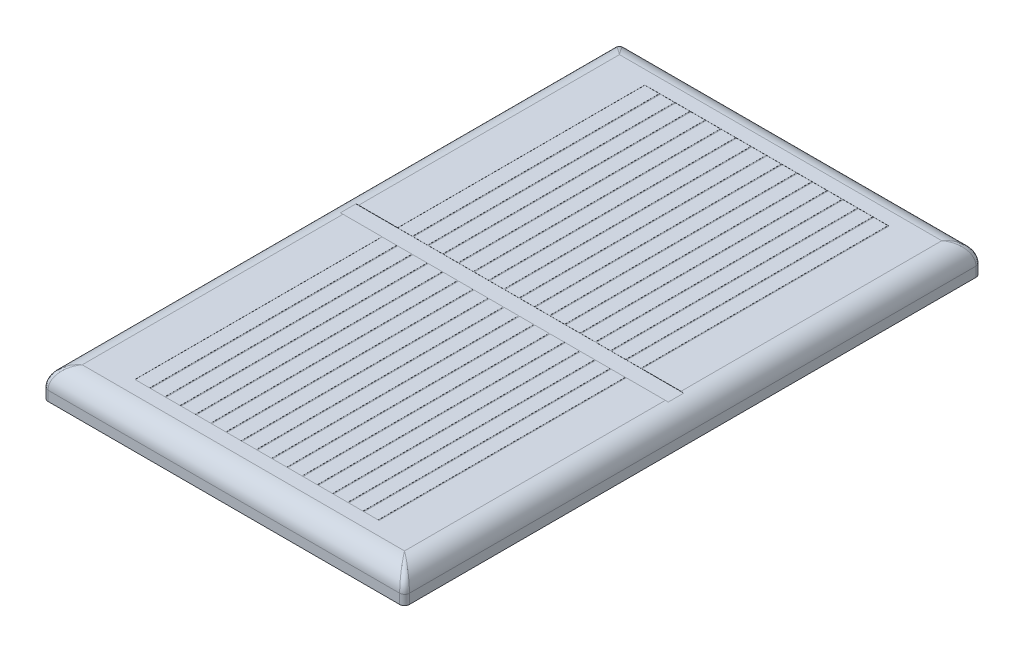
from build123d import *

# Parameters (mm, degrees)
BASES_W                      = 37
BASES_H                      = 59
BASE_DEPTH                   = 1.5
MAINSOLDERPOINTS_R           = 1.5
MAINSOLDERPOINT_DEPTH        = 0.01
SOLDERPOINTS_R               = 1.5
SOLDERPOINT_DEPTH            = 0.01
SOLDERLEG_DEPTH              = 0.005
POLARITYSIGNSS_W             = 4.5
POLARITYSIGNSS_H             = 0.5
POLARITYSIGNS_DEPTH          = 0.005
LIGHTABSORPTIONSECTIONS_W    = 25
LIGHTABSORPTIONSECTIONS_H    = 52.2
LIGHTABSORPTIONSECTION_DEPTH = 0.01
LASSLOTS_W                   = 0.1
LASSLOTS_H                   = 52.2
LASSLOT_DEPTH                = 0.01
LASSLOT_LP_COUNT             = 16
LASSLOT_LP_PITCH             = 1.56
CIRCUITCONNECTION_REACH      = 36.951
CIRCUITCONNECTIONS_W         = 36
CIRCUITCONNECTIONS_H         = 1.6
BASEF_R                      = 2
BASECORNERF_R                = 0.5


with BuildPart() as part:
    # BaseS → Base (new, symmetric)
    with BuildSketch(Plane(origin=(0, 0, 0), x_dir=(1, 0, 0), z_dir=(0, 1, 0))):
        Rectangle(BASES_W, BASES_H)
    extrude(amount=BASE_DEPTH, both=True)

    # MainSolderPointS → MainSolderPoint (add)
    with BuildSketch(Plane(origin=(0, -1.5, 0), x_dir=(-1, 0, 0), z_dir=(0, -1, 0))):
        with Locations(Location((-5, 14.5, 0), (0, 0, 270))):
            Circle(MAINSOLDERPOINTS_R)
    mainsolderpoint = extrude(amount=MAINSOLDERPOINT_DEPTH)

    # SolderPointS → SolderPoint (add)
    with BuildSketch(Plane(origin=(0, -1.5, 0), x_dir=(-1, 0, 0), z_dir=(0, -1, 0))):
        with Locations(Location((-15.5, 0, 0), (0, 0, 270))):
            Circle(SOLDERPOINTS_R)
    solderpoint = extrude(amount=SOLDERPOINT_DEPTH)

    # SolderLegS → SolderLeg (add)
    with BuildSketch(Plane(origin=(0, -1.5, 0), x_dir=(-1, 0, 0), z_dir=(0, -1, 0))):
        with BuildLine():
            Line((-15.5, -1.5), (-5, -1.5))
            ThreePointArc((-5, -1.5), (-3.939339828, -1.060660172), (-3.5, 0))
            Line((-3.5, 0), (-3.5, 14.5))
            ThreePointArc((-3.5, 14.5), (-5, 13), (-6.5, 14.5))
            Line((-6.5, 14.5), (-6.5, 1.7))
            ThreePointArc((-6.5, 1.7), (-6.558578644, 1.558578644), (-6.7, 1.5))
            Line((-6.7, 1.5), (-15.5, 1.5))
            ThreePointArc((-15.5, 1.5), (-14.439339828, 1.060660172), (-14, 0))
            ThreePointArc((-14, 0), (-14.439339828, -1.060660172), (-15.5, -1.5))
        make_face()
    solderleg = extrude(amount=SOLDERLEG_DEPTH)

    # SPPHM: MainSolderPoint, SolderPoint, SolderLeg across plane
    add(mainsolderpoint.mirror(Plane(origin=(0, 0, 0), x_dir=(0, 0, 1), z_dir=(1, 0, 0))))
    add(solderpoint.mirror(Plane(origin=(0, 0, 0), x_dir=(0, 0, 1), z_dir=(1, 0, 0))))
    add(solderleg.mirror(Plane(origin=(0, 0, 0), x_dir=(0, 0, 1), z_dir=(1, 0, 0))))

    # PolaritySignsS → PolaritySigns (add)
    with BuildSketch(Plane(origin=(0, -1.5, 0), x_dir=(-1, 0, 0), z_dir=(0, -1, 0))):
        with Locations((-13, 14.5)):
            Rectangle(POLARITYSIGNSS_W, POLARITYSIGNSS_H)
        Polygon((15.25, 14.25), (13.25, 14.25), (13.25, 12.25), (12.75, 12.25), (12.75, 14.25), (10.75, 14.25), (10.75, 14.75), (12.75, 14.75), (12.75, 16.75), (13.25, 16.75), (13.25, 14.75), (15.25, 14.75), align=None)
    extrude(amount=POLARITYSIGNS_DEPTH)

    # LightAbsorptionSectionS → LightAbsorptionSection (cut)
    with BuildSketch(Plane(origin=(0, 1.5, 0), x_dir=(1, 0, 0), z_dir=(0, 1, 0))):
        Rectangle(LIGHTABSORPTIONSECTIONS_W, LIGHTABSORPTIONSECTIONS_H)
    extrude(amount=-LIGHTABSORPTIONSECTION_DEPTH, mode=Mode.SUBTRACT)

    # LASSlotS → LASSlot (cut)
    with BuildSketch(Plane(origin=(0, 1.49, 0), x_dir=(1, 0, 0), z_dir=(0, 1, 0))):
        with Locations((12.45, 0)):
            Rectangle(LASSLOTS_W, LASSLOTS_H)
    lasslot = extrude(amount=-LASSLOT_DEPTH, mode=Mode.SUBTRACT)

    # LASSlot LP: LASSlot ×16
    with Locations(*[(-i * LASSLOT_LP_PITCH, 0, 0) for i in range(1, LASSLOT_LP_COUNT)]):
        add(lasslot, mode=Mode.SUBTRACT)

    # CircuitConnection: up to this face of the body (flat: up to its plane)
    circuitconnection_end = Plane(part.part.faces().sort_by_distance((12.45, 1.48, 0))[0])
    # CircuitConnectionS → CircuitConnection (cut, up to the picked face)
    with BuildSketch(Plane(origin=(0, 1.5, 0), x_dir=(1, 0, 0), z_dir=(0, 1, 0)), mode=Mode.PRIVATE) as circuitconnection_sk1:
        Rectangle(CIRCUITCONNECTIONS_W, CIRCUITCONNECTIONS_H)
    circuitconnection_tool1 = split(extrude(circuitconnection_sk1.sketch, amount=-CIRCUITCONNECTION_REACH, mode=Mode.PRIVATE), bisect_by=circuitconnection_end, keep=Keep.BOTH, mode=Mode.PRIVATE)
    add(circuitconnection_tool1.solids().sort_by(Axis((0, 1.5, 0), (0, -1, 0)))[0], mode=Mode.SUBTRACT)

    # BaseF
    # the kernel refuses this fillet: 2 mm, written as the material it takes off along each edge
    with BuildSketch(Plane(origin=(23.5, 1.5, 29.5), x_dir=(0, 0, -1), z_dir=(-1, 0, 0))) as basef_piece_1:
        with BuildLine():
            CenterArc((BASEF_R, BASEF_R), BASEF_R, 180, 90)
            Line((0, BASEF_R), (0, 0))
            Line((0, 0), (BASEF_R, 0))
        make_face()
    extrude(amount=47, mode=Mode.SUBTRACT)
    with BuildSketch(Plane(origin=(-18.5, 1.5, 34.5), x_dir=(0, -1, 0), z_dir=(0, 0, -1)), Plane(origin=(18.5, 1.5, -34.5), x_dir=(0, -1, 0), z_dir=(0, 0, 1))) as basef_piece_2:
        with BuildLine():
            CenterArc((BASEF_R, -BASEF_R), BASEF_R, 90, 90)
            Line((0, -BASEF_R), (0, 0))
            Line((0, 0), (BASEF_R, 0))
        make_face()
    extrude(amount=69, mode=Mode.SUBTRACT)
    with BuildSketch(Plane(origin=(-23.5, 1.5, -29.5), x_dir=(0, -1, 0), z_dir=(1, 0, 0))) as basef_piece_3:
        with BuildLine():
            CenterArc((BASEF_R, -BASEF_R), BASEF_R, 90, 90)
            Line((0, -BASEF_R), (0, 0))
            Line((0, 0), (BASEF_R, 0))
        make_face()
    extrude(amount=47, mode=Mode.SUBTRACT)

    # BaseCornerF
    basecornerf_edges = [part.edges().sort_by_distance(p)[0] for p in [
        (18.5, -1, 29.5),
        (-18.5, -1, 29.5),
        (18.5, -1, -29.5),
        (-18.5, -1, -29.5),
        (-17.792097815, 1.026592034, -28.792097815),
        (17.792097815, 1.026592034, -28.792097815),
        (-17.792097815, 1.026592034, 28.792097815),
        (17.792097815, 1.026592034, 28.792097815),
    ]]
    fillet(basecornerf_edges, radius=BASECORNERF_R)


solid = part.part
